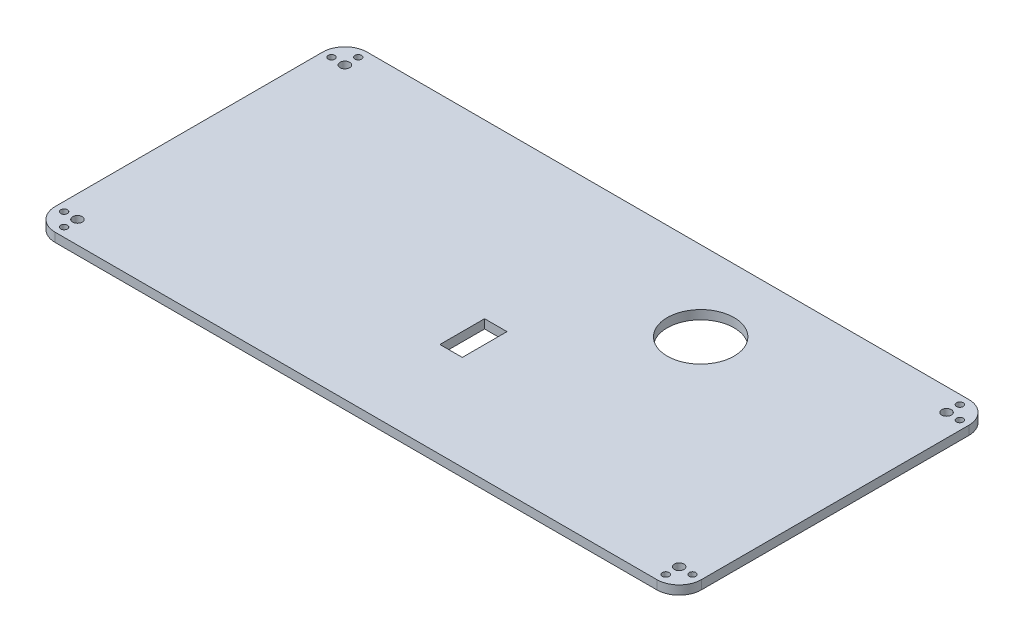
from build123d import *

# Parameters (mm, degrees)
SKETCH1_R               = 1.5
BOSS_EXTRUDE1_DEPTH     = 4
MIRROR2_COPY_1_SKETCH_R = 1.5
MIRROR2_COPY_1_DEPTH    = 4
MIRROR2_COPY_2_SKETCH_R = 1.5
MIRROR2_COPY_2_DEPTH    = 4
SKETCH2_W               = 10.05
SKETCH2_H               = 20.05
CUT_EXTRUDE5_DEPTH      = 162.062099825
SKETCH3_R               = 15
CUT_EXTRUDE6_DEPTH      = 10


with BuildPart() as part:
    # Sketch1 → Boss-Extrude1 (new body)
    with BuildSketch(Plane(origin=(0, 0, 0), x_dir=(1, 0, 0), z_dir=(0, 1, 0))):
        with BuildLine():
            Line((145, -60), (145, 0))
            Line((145, 0), (0, 0))
            Line((0, 0), (0, -70))
            Line((0, -70), (135, -70))
            ThreePointArc((135, -70), (142.071067812, -67.071067812), (145, -60))
        make_face()
        with Locations((135, -66)):
            Circle(SKETCH1_R, mode=Mode.SUBTRACT)
        with BuildLine():
            ThreePointArc((137.15, -60), (133.47972042, -61.52027958), (135, -57.85))
            ThreePointArc((135, -57.85), (136.52027958, -58.47972042), (137.15, -60))
        make_face(mode=Mode.SUBTRACT)
        with Locations((141, -60)):
            Circle(SKETCH1_R, mode=Mode.SUBTRACT)
    boss_extrude1 = extrude(amount=BOSS_EXTRUDE1_DEPTH)

    # Mirror1: Boss-Extrude1 across plane
    add(boss_extrude1.mirror(Plane(origin=(0, 0, 0), x_dir=(0, 0, 1), z_dir=(1, 0, 0))))

    # Mirror2 copy 1 sketch → Mirror2 copy 1 (add)
    with BuildSketch(Plane(origin=(0, 0, 0), x_dir=(-1, 0, 0), z_dir=(0, 1, 0))):
        with BuildLine():
            Line((145, -60), (145, 0))
            Line((145, 0), (0, 0))
            Line((0, 0), (0, -70))
            Line((0, -70), (135, -70))
            ThreePointArc((135, -70), (142.071067812, -67.071067812), (145, -60))
        make_face()
        with Locations((135, -66)):
            Circle(MIRROR2_COPY_1_SKETCH_R, mode=Mode.SUBTRACT)
        with BuildLine():
            ThreePointArc((137.15, -60), (133.47972042, -61.52027958), (135, -57.85))
            ThreePointArc((135, -57.85), (136.52027958, -58.47972042), (137.15, -60))
        make_face(mode=Mode.SUBTRACT)
        with Locations((141, -60)):
            Circle(MIRROR2_COPY_1_SKETCH_R, mode=Mode.SUBTRACT)
    extrude(amount=MIRROR2_COPY_1_DEPTH)

    # Mirror2 copy 2 sketch → Mirror2 copy 2 (add)
    with BuildSketch(Plane(origin=(0, 0, 0), x_dir=(1, 0, 0), z_dir=(0, 1, 0))):
        with BuildLine():
            Line((145, 60), (145, 0))
            Line((145, 0), (0, 0))
            Line((0, 0), (0, 70))
            Line((0, 70), (135, 70))
            ThreePointArc((135, 70), (142.071067812, 67.071067812), (145, 60))
        make_face()
        with Locations((135, 66)):
            Circle(MIRROR2_COPY_2_SKETCH_R, mode=Mode.SUBTRACT)
        with BuildLine():
            ThreePointArc((137.15, 60), (133.47972042, 61.52027958), (135, 57.85))
            ThreePointArc((135, 57.85), (136.52027958, 58.47972042), (137.15, 60))
        make_face(mode=Mode.SUBTRACT)
        with Locations((141, 60)):
            Circle(MIRROR2_COPY_2_SKETCH_R, mode=Mode.SUBTRACT)
    extrude(amount=MIRROR2_COPY_2_DEPTH)

    # Sketch2 → Cut-Extrude5 (cut, through all)
    with BuildSketch(Plane(origin=(0, 4, 0), x_dir=(1, 0, 0), z_dir=(0, 1, 0))):
        with Locations((-0.025, -17.284138883)):
            Rectangle(SKETCH2_W, SKETCH2_H)
    extrude(amount=-CUT_EXTRUDE5_DEPTH, mode=Mode.SUBTRACT)

    # Sketch3 → Cut-Extrude6 (cut)
    with BuildSketch(Plane(origin=(0, 4, 0), x_dir=(1, 0, 0), z_dir=(0, 1, 0))):
        with Locations((50.486348133, 34.179884448)):
            Circle(SKETCH3_R)
    extrude(amount=-CUT_EXTRUDE6_DEPTH, mode=Mode.SUBTRACT)


solid = part.part
